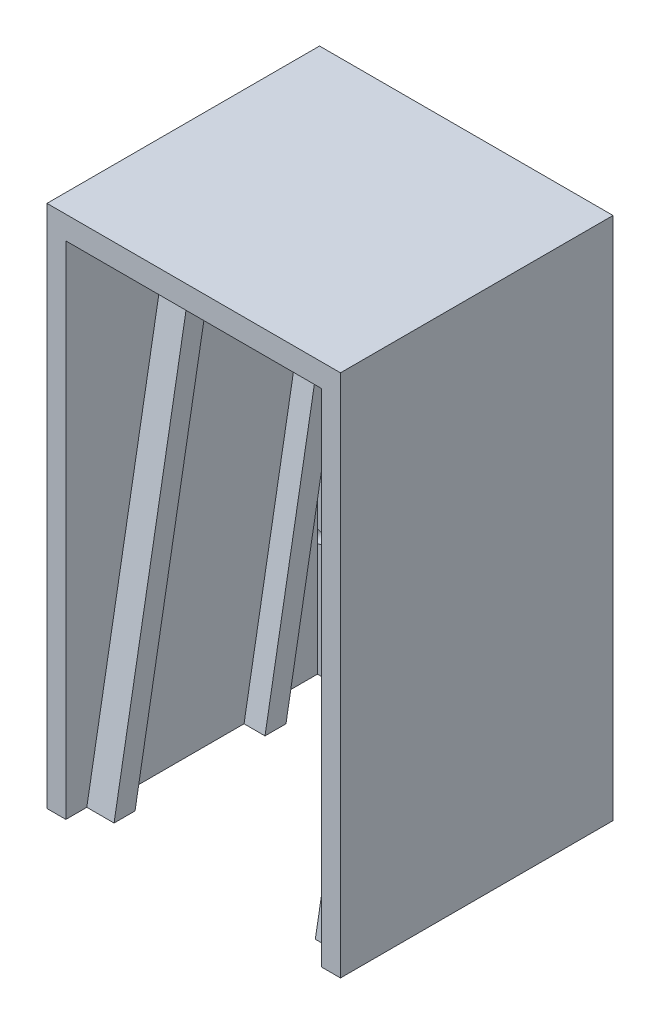
from build123d import *

# Parameters (mm, degrees)
SKETCH1_W             = 72
SKETCH1_H             = 125
BOSS_EXTRUDE1_DEPTH   = 5
SKETCH2_R             = 1.5
CUT_EXTRUDE6_DEPTH    = 5
BOSS_EXTRUDE2_DEPTH   = 60
BOSS_EXTRUDE3_START   = -30.5
BOSS_EXTRUDE3_DEPTH   = 1.5
BOSS_EXTRUDE3_START_2 = 29
BOSS_EXTRUDE3_2_DEPTH = 1.5
BOSS_EXTRUDE3_START_3 = -29
BOSS_EXTRUDE3_3_DEPTH = 5
BOSS_EXTRUDE3_START_4 = 24
BOSS_EXTRUDE3_4_DEPTH = 5
SKETCH5_W             = 1
SKETCH5_H             = 65
SKETCH5_W_2           = 4
CUT_EXTRUDE7_DEPTH    = 158


# Read off the part's stored shape, not the designer's step: Boss-Extrude3
with BuildPart() as part:
    # Sketch1 → Boss-Extrude1 (new body)
    with BuildSketch(Plane(origin=(0, 0, 0), x_dir=(-1, 0, 0), z_dir=(0, 0, 1))):
        with Locations((0, -8.5305)):
            Rectangle(SKETCH1_W, SKETCH1_H)
    extrude(amount=BOSS_EXTRUDE1_DEPTH)

    # Sketch2 → Cut-Extrude6 (cut)
    with BuildSketch(Plane(origin=(0, 0, 0), x_dir=(-1, 0, 0), z_dir=(0, 0, 1))):
        with Locations(Location((30.5, -67.5305, 0), (0, 0, 180))):
            Circle(SKETCH2_R)
        with Locations(Location((-30.5, -67.5305, 0), (0, 0, 180))):
            Circle(SKETCH2_R)
        with Locations(Location((30.5, 25.4695, 0), (0, 0, 180))):
            Circle(SKETCH2_R)
        with Locations(Location((-30.5, 25.4695, 0), (0, 0, 180))):
            Circle(SKETCH2_R)
        with Locations(Location((0, -21.0305, 0), (0, 0, 180))):
            Circle(SKETCH2_R)
    extrude(amount=CUT_EXTRUDE6_DEPTH, mode=Mode.SUBTRACT)

    # Sketch3 → Boss-Extrude2 (add)
    with BuildSketch(Plane.XY.offset(5)):
        Polygon((-30.5, -53.9695), (-30.5, 65.5305), (30.5, 65.5305), (30.5, -53.9695), (36, -53.9695), (36, 71.0305), (-36, 71.0305), (-36, -53.9695), align=None)
    extrude(amount=BOSS_EXTRUDE2_DEPTH)

    # Boss-Extrude3 outline → Boss-Extrude3 (add)
    with BuildSketch(Plane.YZ.offset(BOSS_EXTRUDE3_START)):
        Polygon((-53.9695, 19), (25.428445475, 5), (65.5305, 5), (65.5305, 38.928925805), (-53.9695, 60), align=None)
    extrude(amount=BOSS_EXTRUDE3_DEPTH)

    # Boss-Extrude3 2 outline → Boss-Extrude3 2 (add)
    with BuildSketch(Plane.YZ.offset(BOSS_EXTRUDE3_START_2)):
        Polygon((-53.9695, 19), (25.428445475, 5), (65.5305, 5), (65.5305, 38.928925805), (-53.9695, 60), align=None)
    extrude(amount=BOSS_EXTRUDE3_2_DEPTH)

    # Boss-Extrude3 3 outline → Boss-Extrude3 3 (add)
    with BuildSketch(Plane.YZ.offset(BOSS_EXTRUDE3_START_3)):
        Polygon((-53.9695, 24), (-53.9695, 19), (25.428445475, 5), (53.784854573, 5), align=None)
        Polygon((-53.9695, 60), (-53.9695, 55), (65.5305, 33.928925805), (65.5305, 38.928925805), align=None)
    extrude(amount=BOSS_EXTRUDE3_3_DEPTH)

    # Boss-Extrude3 4 outline → Boss-Extrude3 4 (add)
    with BuildSketch(Plane.YZ.offset(BOSS_EXTRUDE3_START_4)):
        Polygon((-53.9695, 24), (-53.9695, 19), (25.428445475, 5), (53.784854573, 5), align=None)
        Polygon((-53.9695, 60), (-53.9695, 55), (65.5305, 33.928925805), (65.5305, 38.928925805), align=None)
    extrude(amount=BOSS_EXTRUDE3_4_DEPTH)

    # Sketch5 → Cut-Extrude7 (cut)
    with BuildSketch(Plane(origin=(0, 71.0305, 0), x_dir=(1, 0, 0), z_dir=(0, 1, 0))):
        with Locations((-35.5, -32.5)):
            Rectangle(SKETCH5_W, SKETCH5_H)
        with Locations((-38, -32.5)):
            Rectangle(SKETCH5_W_2, SKETCH5_H)
        with Locations((38, -32.5)):
            Rectangle(SKETCH5_W_2, SKETCH5_H)
        with Locations((35.5, -32.5)):
            Rectangle(SKETCH5_W, SKETCH5_H)
    extrude(amount=-CUT_EXTRUDE7_DEPTH, mode=Mode.SUBTRACT)


solid = part.part
